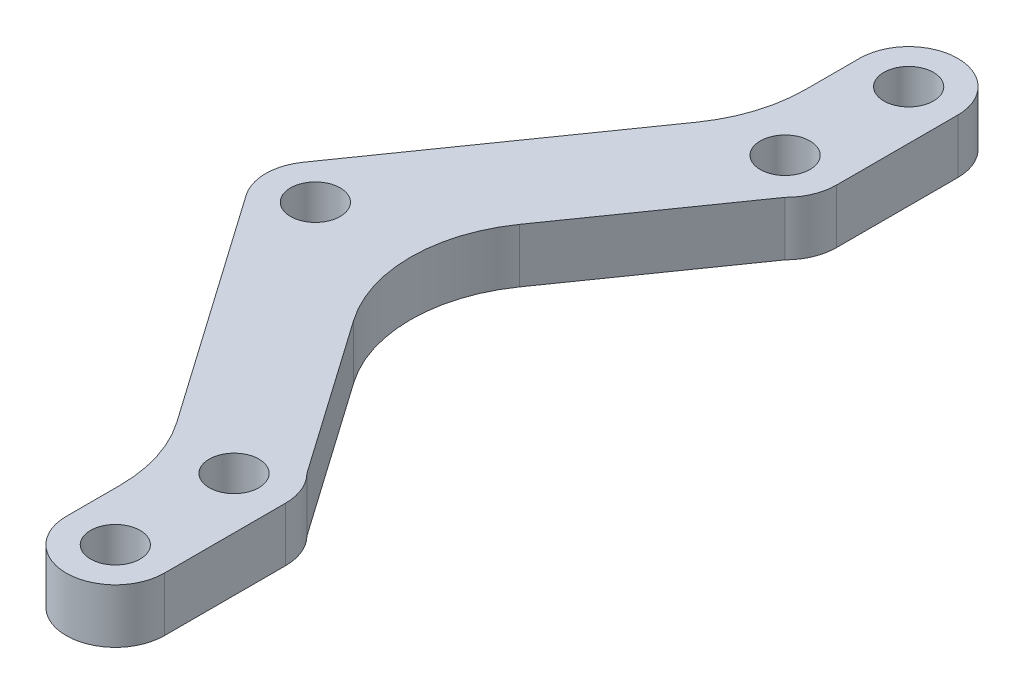
from build123d import *

# Parameters (mm, degrees)
BOSS_EXTRUDE1_DEPTH = 3
SKETCH3_R           = 1.375
CUT_EXTRUDE1_DEPTH  = 39.004540039
FILLET1_R           = 8


with BuildPart() as part:
    # Sketch2 → Boss-Extrude1 (new body)
    with BuildSketch(Plane(origin=(0, 0, 0), x_dir=(1, 0, 0), z_dir=(0, 1, 0))):
        with BuildLine():
            Line((-27.375, 0), (-28.75, 0))
            ThreePointArc((-28.75, 0), (-28.622713939, 0.826965294), (-28.252638839, 1.57737702))
            Line((-28.252638839, 1.57737702), (-17.83457622, 16.455324516))
            Line((-17.83457622, 16.455324516), (-17.83457622, 21.955324516))
            ThreePointArc((-17.83457622, 21.955324516), (-15.116381256, 24.67351948), (-12.398186292, 21.955324516))
            Line((-12.398186292, 21.955324516), (-12.398186292, 15.25))
            ThreePointArc((-12.398186292, 15.25), (-12.615267685, 14.158658142), (-13.233463188, 13.233463188))
            Line((-13.233463188, 13.233463188), (-22.5, 0))
            Line((-22.5, 0), (-24.625, 0))
            ThreePointArc((-24.625, 0), (-26, 1.375), (-27.375, 0))
        make_face()
    boss_extrude1 = extrude(amount=BOSS_EXTRUDE1_DEPTH)

    # Sketch3 → Cut-Extrude1 (cut, through all)
    with BuildSketch(Plane(origin=(0, 3, 0), x_dir=(1, 0, 0), z_dir=(0, 1, 0))):
        with Locations((-15.25, 15.25)):
            Circle(SKETCH3_R)
        with Locations((-15.116381256, 21.955324516)):
            Circle(SKETCH3_R)
    cut_extrude1 = extrude(amount=-CUT_EXTRUDE1_DEPTH, mode=Mode.SUBTRACT)

    # Mirror2: Boss-Extrude1, Cut-Extrude1 across plane
    add(boss_extrude1.mirror(Plane(origin=(-22.5, 3, 0), x_dir=(1, 0, 0), z_dir=(0, 0, -1))))
    add(cut_extrude1.mirror(Plane(origin=(-22.5, 3, 0), x_dir=(1, 0, 0), z_dir=(0, 0, -1))), mode=Mode.SUBTRACT)

    # Fillet1
    fillet1_edges = [part.edges().sort_by_distance(p)[0] for p in [
        (-22.5, 1.5, 0),
        (-17.83457622, 1.5, 16.455324516),
        (-17.83457622, 1.5, -16.455324516),
    ]]
    fillet(fillet1_edges, radius=FILLET1_R)


solid = part.part
